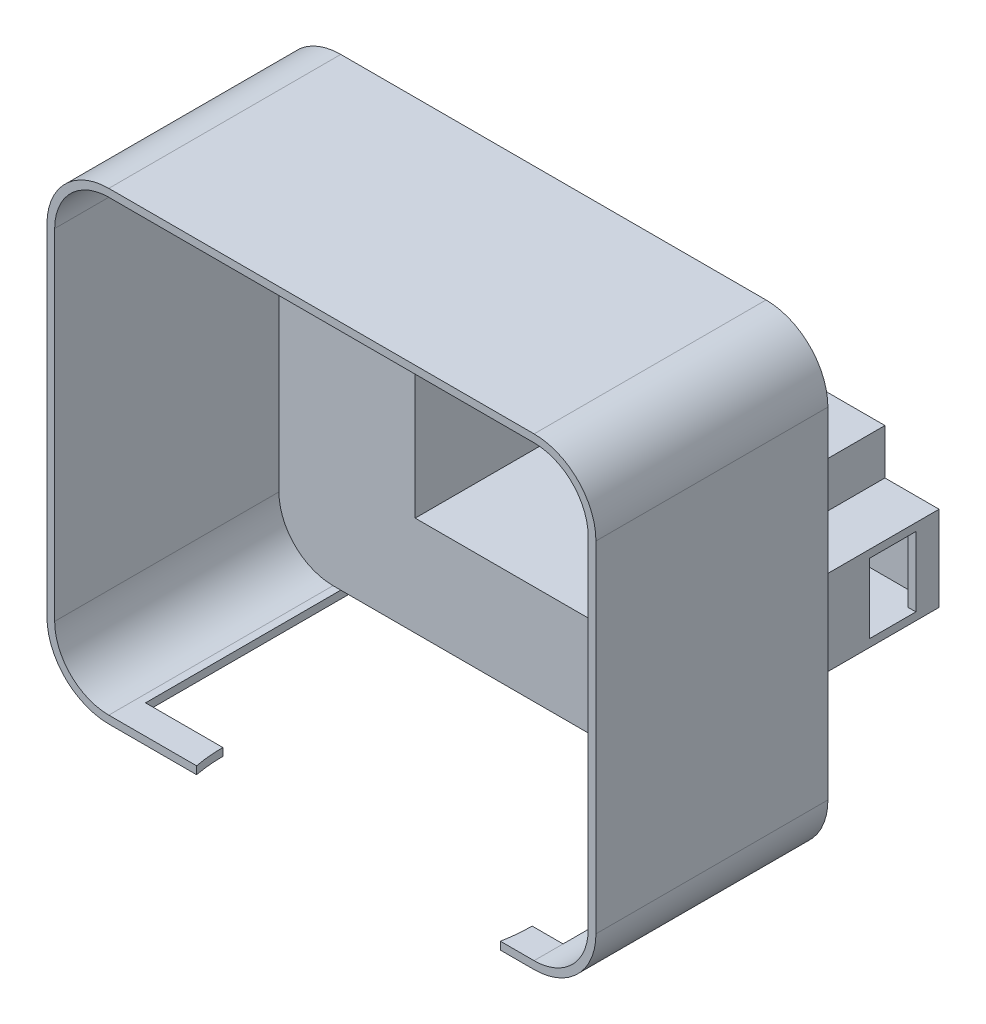
from build123d import *

# Parameters (mm, degrees)
SKETCH1_W               = 60
SKETCH1_H               = 51
BOSS_EXTRUDE3_DEPTH     = 48
CUT_EXTRUDE1_DEPTH      = 18
CUT_EXTRUDE2_DEPTH      = 77.190550595
CUT_EXTRUDE2_DEPTH_BACK = 11.25
SKETCH2_W               = 40
SKETCH2_H               = 18
BOSS_EXTRUDE4_DEPTH     = 30
FILLET1_R               = 8
SHELL1_T                = -1
CUT_EXTRUDE5_START      = -1
CUT_EXTRUDE5_DEPTH      = 1
SKETCH5_W               = 6
SKETCH5_H               = 9
CUT_EXTRUDE4_DEPTH      = 1


# Read off the part's stored shape, not the designer's step: Cut-Extrude5
with BuildPart() as part:
    # Sketch1 → Boss-Extrude3 (new body)
    with BuildSketch(Plane(origin=(0, 0, 0), x_dir=(-1, 0, 0), z_dir=(0, 0, -1))):
        Rectangle(SKETCH1_W, SKETCH1_H)
    extrude(amount=-BOSS_EXTRUDE3_DEPTH)

    # Sketch1<6> → Cut-Extrude1 (cut)
    with BuildSketch(Plane(origin=(0, 0, 0), x_dir=(-1, 0, 0), z_dir=(0, 0, -1))):
        Polygon((-20, -25.5), (-20, -14.25), (20, -14.25), (20, -25.5), (30, -25.5), (30, 25.5), (-30, 25.5), (-30, -25.5), align=None)
        Polygon((21.375, -12.625), (-21.375, -12.625), (-21.375, -6.75), (-28.375, -6.75), (-28.375, 4.25), (-21.375, 4.25), (-21.375, 10.125), (21.375, 10.125), align=None, mode=Mode.SUBTRACT)
    extrude(amount=-CUT_EXTRUDE1_DEPTH, mode=Mode.SUBTRACT)

    # Sketch2 → Cut-Extrude2 (cut, two sides: drawn at the far end of the back side and taken through both)
    with BuildSketch(Plane.XZ.offset(25.5).offset(-CUT_EXTRUDE2_DEPTH_BACK)):
        with Locations((0, 9)):
            Rectangle(SKETCH2_W, SKETCH2_H)
    extrude(amount=CUT_EXTRUDE2_DEPTH + CUT_EXTRUDE2_DEPTH_BACK, mode=Mode.SUBTRACT)

    # Sketch6 → Boss-Extrude4 (add)
    with BuildSketch(Plane.XY.offset(48)):
        Polygon((30, 25.5), (30, -25.5), (32, -25.5), (32, 34.5), (-39, 34.5), (-39, -25.5), (-30, -25.5), (-30, 25.5), align=None)
    extrude(amount=-BOSS_EXTRUDE4_DEPTH)

    # Fillet1
    fillet1_edges = [part.edges().sort_by_distance(p)[0] for p in [
        (-39, 34.5, 33),
        (32, 34.5, 33),
        (32, -25.5, 33),
        (-39, -25.5, 33),
    ]]
    fillet(fillet1_edges, radius=FILLET1_R)

    # Shell1
    shell1_openings = [part.faces().sort_by_distance(p)[0] for p in [
        (-3.5, 4.5, 48),
    ]]
    offset(amount=SHELL1_T, openings=shell1_openings, kind=Kind.INTERSECTION)

    # Cut-Extrude5 outline → Cut-Extrude5 (cut)
    with BuildSketch(Plane.XZ.offset(25.5).offset(CUT_EXTRUDE5_START)):
        with BuildLine():
            Line((29, 44.25), (20, 44.25))
            ThreePointArc((20, 44.25), (19.911125548, 46.13336917), (19.645292057, 48))
            Line((19.645292057, 48), (-19.645292057, 48))
            ThreePointArc((-19.645292057, 48), (-19.911125548, 46.13336917), (-20, 44.25))
            Line((-20, 44.25), (-30, 44.25))
            Line((-30, 44.25), (-30, 17))
            Line((-30, 17), (29, 17))
            Line((29, 17), (29, 44.25))
        make_face()
    extrude(amount=CUT_EXTRUDE5_DEPTH, mode=Mode.SUBTRACT)

    # Sketch5 → Cut-Extrude4 (cut)
    with BuildSketch(Plane(origin=(28.375, 0, 0), x_dir=(0, 0, -1), z_dir=(1, 0, 0))):
        with Locations((-6, -1.25)):
            Rectangle(SKETCH5_W, SKETCH5_H)
    extrude(amount=-CUT_EXTRUDE4_DEPTH, mode=Mode.SUBTRACT)


solid = part.part
